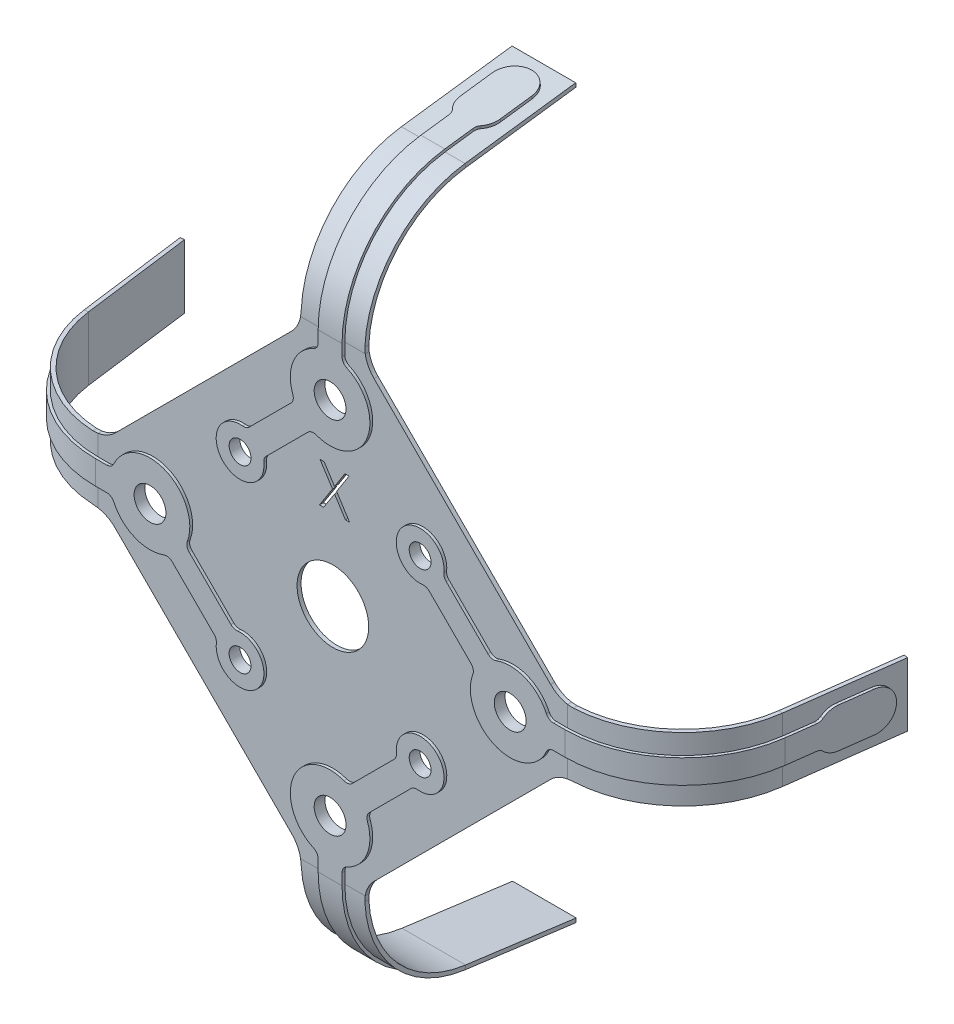
from build123d import *
from build123d.topology import SkipClean

# Parameters (mm, degrees)
SKETCH1_R                   = 0.2286
BASE_FLANGE1_DEPTH          = 0.0254
BEND_START                  = -0.2032
BEND_2_LOOP_DEPTH           = 0.4064
BEND_2_LOOP_2_DEPTH         = 0.4064
BEND_2_LOOP_3_DEPTH         = 0.4064
BEND_START_2                = 2.987052505
BEND_2_LOOP_4_OUTLINE_W     = 0.4064
BEND_2_LOOP_4_OUTLINE_H     = 0.0254
BEND_2_LOOP_4_DEPTH         = 0.264147495
BEND_START_3                = -3.2512
BEND_2_LOOP_5_OUTLINE_W     = 0.4064
BEND_2_LOOP_5_OUTLINE_H     = 0.0254
BEND_2_LOOP_5_DEPTH         = 0.23603712
BEND_2_LOOP_6_DEPTH         = 0.4064
BEND_START_4                = 2.994255163
BEND_2_LOOP_7_OUTLINE_W     = 0.4064
BEND_2_LOOP_7_OUTLINE_H     = 0.0254
BEND_2_LOOP_7_DEPTH         = 0.256944837
BEND_2_LOOP_8_OUTLINE_W     = 0.4064
BEND_2_LOOP_8_OUTLINE_H     = 0.0254
BEND_2_LOOP_8_DEPTH         = 0.243239778
SKETCH14_R                  = 0.06985
SKETCH14_R_2                = 0.1016
BE_00_TRACE_CENTER_DEPTH    = 0.01778
BE_00_TRACE_ARM_END_DEPTH   = 0.01778
BE_00_TRACE_LINK_DEPTH      = 0.0762
BE_00_START                 = -0.0254
SKETCH17_R                  = 0.254
BE_00_TRACE_CAP_LOWER_DEPTH = 0.0254
BOSS_EXTRUDE1_START         = 0.0254
SKETCH23_R                  = 0.1524
BOSS_EXTRUDE1_DEPTH         = 0.0254
SKETCH18_R                  = 0.1016
SKETCH18_R_2                = 0.06985
CE_00_HOLES_CENTER_DEPTH    = 0.127
CIRPATTERN1_COUNT           = 4
CUT_EXTRUDE4_DEPTH          = 0.1016


# Read off the part's stored shape, not the designer's step: Bend 2 Loop
# Sheet-metal steps are written as plain solids
with BuildPart() as part:
    # Sketch1 → Base-Flange1 (new body)
    with BuildSketch(Plane.XY):
        with BuildLine():
            Line((3.2512, -0.2032), (3.2512, 0.2032))
            Line((3.2512, 0.2032), (1.533335322, 0.2032))
            ThreePointArc((1.533335322, 0.2032), (1.455574049, 0.218667679), (1.389651224, 0.262715902))
            Line((1.389651224, 0.262715902), (0.262715902, 1.389651224))
            ThreePointArc((0.262715902, 1.389651224), (0.218667679, 1.455574049), (0.2032, 1.533335322))
            Line((0.2032, 1.533335322), (0.2032, 3.2512))
            Line((0.2032, 3.2512), (-0.2032, 3.2512))
            Line((-0.2032, 3.2512), (-0.2032, 1.533335322))
            ThreePointArc((-0.2032, 1.533335322), (-0.218667679, 1.455574049), (-0.262715902, 1.389651224))
            Line((-0.262715902, 1.389651224), (-1.389651224, 0.262715902))
            ThreePointArc((-1.389651224, 0.262715902), (-1.455574049, 0.218667679), (-1.533335322, 0.2032))
            Line((-1.533335322, 0.2032), (-3.2512, 0.2032))
            Line((-3.2512, 0.2032), (-3.2512, -0.2032))
            Line((-3.2512, -0.2032), (-1.533335322, -0.2032))
            ThreePointArc((-1.533335322, -0.2032), (-1.455574049, -0.218667679), (-1.389651224, -0.262715902))
            Line((-1.389651224, -0.262715902), (-0.262715902, -1.389651224))
            ThreePointArc((-0.262715902, -1.389651224), (-0.218667679, -1.455574049), (-0.2032, -1.533335322))
            Line((-0.2032, -1.533335322), (-0.2032, -3.2512))
            Line((-0.2032, -3.2512), (0.2032, -3.2512))
            Line((0.2032, -3.2512), (0.2032, -1.533335322))
            ThreePointArc((0.2032, -1.533335322), (0.218667679, -1.455574049), (0.262715902, -1.389651224))
            Line((0.262715902, -1.389651224), (1.389651224, -0.262715902))
            ThreePointArc((1.389651224, -0.262715902), (1.455574049, -0.218667679), (1.533335322, -0.2032))
            Line((1.533335322, -0.2032), (3.2512, -0.2032))
        make_face()
        Circle(SKETCH1_R, mode=Mode.SUBTRACT)
    extrude(amount=BASE_FLANGE1_DEPTH)

    # Bend 2 Loop outline → Bend 2 Loop (add)
    with BuildSketch(Plane(origin=(0, 0, 0), x_dir=(1, 0, 0), z_dir=(0, 1, 0)).offset(BEND_START)):
        with BuildLine():
            Line((1.4986, 0), (1.690365794, 0))
            ThreePointArc((1.690365794, 0), (2.052787263, 0.225961876), (2.228898285, 0.615054407))
            Line((2.228898285, 0.615054407), (2.321892092, 1.321412501))
            Line((2.321892092, 1.321412501), (2.296709393, 1.324727866))
            Line((2.296709393, 1.324727866), (2.203715585, 0.618369772))
            ThreePointArc((2.203715585, 0.618369772), (1.967526744, 0.176491529), (1.4986, 0))
        make_face()
        with BuildLine():
            ThreePointArc((-2.228898285, 0.615054407), (-2.052787263, 0.225961876), (-1.690365794, 0))
            Line((-1.690365794, 0), (-1.4986, 0))
            ThreePointArc((-1.4986, 0), (-1.967526744, 0.176491529), (-2.203715585, 0.618369772))
            Line((-2.203715585, 0.618369772), (-2.296709393, 1.324727866))
            Line((-2.296709393, 1.324727866), (-2.321892092, 1.321412501))
            Line((-2.321892092, 1.321412501), (-2.228898285, 0.615054407))
        make_face()
    extrude(amount=BEND_2_LOOP_DEPTH)

    # Bend 2 Loop 2 outline → Bend 2 Loop 2 (add)
    with BuildSketch(Plane.YZ.offset(BEND_START)):
        with BuildLine():
            ThreePointArc((2.228898285, -0.615054407), (2.052787263, -0.225961876), (1.690365794, 0))
            Line((1.690365794, 0), (1.4986, 0))
            ThreePointArc((1.4986, 0), (1.967526744, -0.176491529), (2.203715585, -0.618369772))
            Line((2.203715585, -0.618369772), (2.296709393, -1.324727866))
            Line((2.296709393, -1.324727866), (2.321892092, -1.321412501))
            Line((2.321892092, -1.321412501), (2.228898285, -0.615054407))
        make_face()
        with BuildLine():
            Line((-1.4986, 0), (-1.690365794, 0))
            ThreePointArc((-1.690365794, 0), (-2.052787263, -0.225961876), (-2.228898285, -0.615054407))
            Line((-2.228898285, -0.615054407), (-2.321892092, -1.321412501))
            Line((-2.321892092, -1.321412501), (-2.296709393, -1.324727866))
            Line((-2.296709393, -1.324727866), (-2.203715585, -0.618369772))
            ThreePointArc((-2.203715585, -0.618369772), (-1.967526744, -0.176491529), (-1.4986, 0))
        make_face()
    extrude(amount=BEND_2_LOOP_2_DEPTH)

    # Bend 2 Loop 3 outline → Bend 2 Loop 3 (cut)
    with BuildSketch(Plane(origin=(0, 0, 0), x_dir=(1, 0, 0), z_dir=(0, 1, 0)).offset(BEND_START)):
        with BuildLine():
            ThreePointArc((1.690365794, 0), (1.595320318, -0.019022391), (1.4986, -0.0254))
            Line((1.4986, -0.0254), (3.2512, -0.0254))
            Line((3.2512, -0.0254), (3.2512, 0))
            Line((3.2512, 0), (1.690365794, 0))
        make_face()
        with BuildLine():
            Line((-3.2512, -0.0254), (-1.4986, -0.0254))
            ThreePointArc((-1.4986, -0.0254), (-1.595320318, -0.019022391), (-1.690365794, 0))
            Line((-1.690365794, 0), (-3.2512, 0))
            Line((-3.2512, 0), (-3.2512, -0.0254))
        make_face()
    extrude(amount=BEND_2_LOOP_3_DEPTH, mode=Mode.SUBTRACT)

    # Bend 2 Loop 4 outline → Bend 2 Loop 4 (cut)
    with BuildSketch(Plane(origin=(0, 0, 0), x_dir=(1, 0, 0), z_dir=(0, 1, 0)).offset(BEND_START_2)):
        with Locations((0, -0.0127)):
            Rectangle(BEND_2_LOOP_4_OUTLINE_W, BEND_2_LOOP_4_OUTLINE_H)
    extrude(amount=BEND_2_LOOP_4_DEPTH, mode=Mode.SUBTRACT)

    # Bend 2 Loop 5 outline → Bend 2 Loop 5 (cut)
    with BuildSketch(Plane(origin=(0, 0, 0), x_dir=(1, 0, 0), z_dir=(0, 1, 0)).offset(BEND_START_3)):
        with Locations((0, -0.0127)):
            Rectangle(BEND_2_LOOP_5_OUTLINE_W, BEND_2_LOOP_5_OUTLINE_H)
    extrude(amount=BEND_2_LOOP_5_DEPTH, mode=Mode.SUBTRACT)

    # Bend 2 Loop 6 outline → Bend 2 Loop 6 (cut)
    with BuildSketch(Plane.YZ.offset(BEND_START)):
        with BuildLine():
            Line((3.2512, 0.0254), (1.4986, 0.0254))
            ThreePointArc((1.4986, 0.0254), (1.595320318, 0.019022391), (1.690365794, 0))
            Line((1.690365794, 0), (3.2512, 0))
            Line((3.2512, 0), (3.2512, 0.0254))
        make_face()
        with BuildLine():
            ThreePointArc((-1.690365794, 0), (-1.595320318, 0.019022391), (-1.4986, 0.0254))
            Line((-1.4986, 0.0254), (-3.2512, 0.0254))
            Line((-3.2512, 0.0254), (-3.2512, 0))
            Line((-3.2512, 0), (-1.690365794, 0))
        make_face()
    extrude(amount=BEND_2_LOOP_6_DEPTH, mode=Mode.SUBTRACT)

    # Bend 2 Loop 7 outline → Bend 2 Loop 7 (cut)
    with BuildSketch(Plane.YZ.offset(BEND_START_4)):
        with Locations((0, 0.0127)):
            Rectangle(BEND_2_LOOP_7_OUTLINE_W, BEND_2_LOOP_7_OUTLINE_H)
    extrude(amount=BEND_2_LOOP_7_DEPTH, mode=Mode.SUBTRACT)

    # Bend 2 Loop 8 outline → Bend 2 Loop 8 (cut)
    with BuildSketch(Plane.YZ.offset(BEND_START_3)):
        with Locations((0, 0.0127)):
            Rectangle(BEND_2_LOOP_8_OUTLINE_W, BEND_2_LOOP_8_OUTLINE_H)
    extrude(amount=BEND_2_LOOP_8_DEPTH, mode=Mode.SUBTRACT)

    # Sketch14 → BE-00 Trace Center (add)
    with BuildSketch(Plane.XY.offset(0.0254)):
        with BuildLine():
            Line((0.633018218, 0.408691492), (0.899665189, 0.142044521))
            ThreePointArc((0.899665189, 0.142044521), (0.913375782, 0.116955973), (0.911365601, 0.088436247))
            ThreePointArc((0.911365601, 0.088436247), (1.052271192, -0.234665401), (1.380373857, -0.105833333))
            ThreePointArc((1.380373857, -0.105833333), (1.399118936, -0.084245429), (1.426554071, -0.0762))
            Line((1.426554071, -0.0762), (1.454272783, -0.0762))
            Line((1.454272783, -0.0762), (1.454272783, 0.0762))
            Line((1.454272783, 0.0762), (1.426554071, 0.0762))
            ThreePointArc((1.426554071, 0.0762), (1.399118936, 0.084245429), (1.380373857, 0.105833333))
            ThreePointArc((1.380373857, 0.105833333), (1.246674375, 0.234665401), (1.061036537, 0.238107182))
            ThreePointArc((1.061036537, 0.238107182), (1.032516811, 0.236097001), (1.007428263, 0.249807594))
            Line((1.007428263, 0.249807594), (0.740781291, 0.516454565))
            ThreePointArc((0.740781291, 0.516454565), (0.728769282, 0.535551076), (0.726210835, 0.55796579))
            ThreePointArc((0.726210835, 0.55796579), (0.466973318, 0.682499465), (0.591506993, 0.423261949))
            ThreePointArc((0.591506993, 0.423261949), (0.613921708, 0.420703501), (0.633018218, 0.408691492))
        make_face()
        with Locations((0.574736392, 0.574736392)):
            Circle(SKETCH14_R, mode=Mode.SUBTRACT)
        with Locations((1.149472783, 0)):
            Circle(SKETCH14_R_2, mode=Mode.SUBTRACT)
    be_00_trace_center = extrude(amount=BE_00_TRACE_CENTER_DEPTH)

    # Sketch15 → BE-00 Trace Arm End (add)
    with BuildSketch(Plane(origin=(1.921275113, 0, 1.721575567), x_dir=(0.1305261922200484, 0, -0.9914448613738109), z_dir=(0.9914448613738109, 0, 0.1305261922200484))):
        with BuildLine():
            Line((2.538411813, 0.0762), (2.459645892, 0.0762))
            Line((2.459645892, 0.0762), (2.459645892, -0.0762))
            Line((2.459645892, -0.0762), (2.538411813, -0.0762))
            ThreePointArc((2.538411813, -0.0762), (2.557612408, -0.079968339), (2.573964407, -0.090714286))
            ThreePointArc((2.573964407, -0.090714286), (2.614844404, -0.117579153), (2.662845892, -0.127))
            Line((2.662845892, -0.127), (2.866045892, -0.127))
            ThreePointArc((2.866045892, -0.127), (2.993045892, 0), (2.866045892, 0.127))
            Line((2.866045892, 0.127), (2.662845892, 0.127))
            ThreePointArc((2.662845892, 0.127), (2.614844404, 0.117579153), (2.573964407, 0.090714286))
            ThreePointArc((2.573964407, 0.090714286), (2.557612408, 0.079968339), (2.538411813, 0.0762))
        make_face()
    be_00_trace_arm_end = extrude(amount=BE_00_TRACE_ARM_END_DEPTH)

    # Sketch21 → BE-00 Trace Link (add, symmetric)
    with BuildSketch(Plane(origin=(0, 0, 0), x_dir=(1, 0, 0), z_dir=(0, 1, 0))):
        with BuildLine():
            Line((1.454272783, -0.04318), (1.4986, -0.04318))
            ThreePointArc((1.4986, -0.04318), (1.995997296, 0.144027086), (2.246526175, 0.612733651))
            Line((2.246526175, 0.612733651), (2.259951215, 0.714706957))
            Line((2.259951215, 0.714706957), (2.222177166, 0.719680005))
            Line((2.222177166, 0.719680005), (2.208752125, 0.617706699))
            ThreePointArc((2.208752125, 0.617706699), (1.97087622, 0.172672183), (1.4986, -0.00508))
            Line((1.4986, -0.00508), (1.454272783, -0.00508))
            Line((1.454272783, -0.00508), (1.454272783, -0.04318))
        make_face()
    be_00_trace_link = extrude(amount=BE_00_TRACE_LINK_DEPTH, both=True)

    # Sketch17 → BE-00 Trace Cap Lower (add)
    with BuildSketch(Plane.XY.offset(BE_00_START)):
        with Locations((1.149472783, 0)):
            Circle(SKETCH17_R)
    be_00_trace_cap_lower = extrude(amount=BE_00_TRACE_CAP_LOWER_DEPTH)

    # Sketch23 → Boss-Extrude1 (add)
    with BuildSketch(Plane(origin=(0, 0, 0), x_dir=(-1, 0, 0), z_dir=(0, 0, -1)).offset(BOSS_EXTRUDE1_START)):
        with Locations((-0.574736392, 0.574736392)):
            Circle(SKETCH23_R)
    boss_extrude1 = extrude(amount=-BOSS_EXTRUDE1_DEPTH)

    # Sketch18 → CE-00 Holes Center (cut, symmetric)
    with SkipClean():  # the faces are left unmerged after this step: merging them gives an invalid solid
        with BuildSketch(Plane.XY):
            with Locations((1.149472783, 0)):
                Circle(SKETCH18_R)
            with Locations(Location((0.574736392, 0.574736392, 0), (0, 0, 180))):
                Circle(SKETCH18_R_2)
        ce_00_holes_center = extrude(amount=CE_00_HOLES_CENTER_DEPTH, both=True, mode=Mode.SUBTRACT)
    add(part.part.scale(1), mode=Mode.REPLACE)  # the faces are merged on a copy

    # CirPattern1: BE-00 Trace Center, BE-00 Trace Arm End, BE-00 Trace Link, BE-00 Trace Cap Lower, Boss-Extrude1, CE-00 Holes Center ×4 about axis
    cirpattern1_axis = Axis((0, 0, 0), (0, 0, 1))
    add([be_00_trace_center.rotate(cirpattern1_axis, i * 360 / CIRPATTERN1_COUNT) for i in range(1, CIRPATTERN1_COUNT)])
    add([be_00_trace_arm_end.rotate(cirpattern1_axis, i * 360 / CIRPATTERN1_COUNT) for i in range(1, CIRPATTERN1_COUNT)])
    add([be_00_trace_link.rotate(cirpattern1_axis, i * 360 / CIRPATTERN1_COUNT) for i in range(1, CIRPATTERN1_COUNT)])
    add([be_00_trace_cap_lower.rotate(cirpattern1_axis, i * 360 / CIRPATTERN1_COUNT) for i in range(1, CIRPATTERN1_COUNT)])
    add([boss_extrude1.rotate(cirpattern1_axis, i * 360 / CIRPATTERN1_COUNT) for i in range(1, CIRPATTERN1_COUNT)])
    add([ce_00_holes_center.rotate(cirpattern1_axis, i * 360 / CIRPATTERN1_COUNT) for i in range(1, CIRPATTERN1_COUNT)], mode=Mode.SUBTRACT)

    # Sketch24 → Cut-Extrude4 (cut)
    with BuildSketch(Plane.XY.offset(0.0254)):
        Polygon((-0.082205882, 0.771144675), (-0.055900193, 0.771144675), (0.01060181, 0.667244835), (0.077103813, 0.771144675), (0.103409502, 0.771144675), (0.023780095, 0.646688746), (0.106665912, 0.517144675), (0.080360223, 0.517144675), (0.01060181, 0.626132656), (-0.059156604, 0.517144675), (-0.085462293, 0.517144675), (-0.002525594, 0.646688746), align=None)
    extrude(amount=-CUT_EXTRUDE4_DEPTH, mode=Mode.SUBTRACT)


solid = part.part
